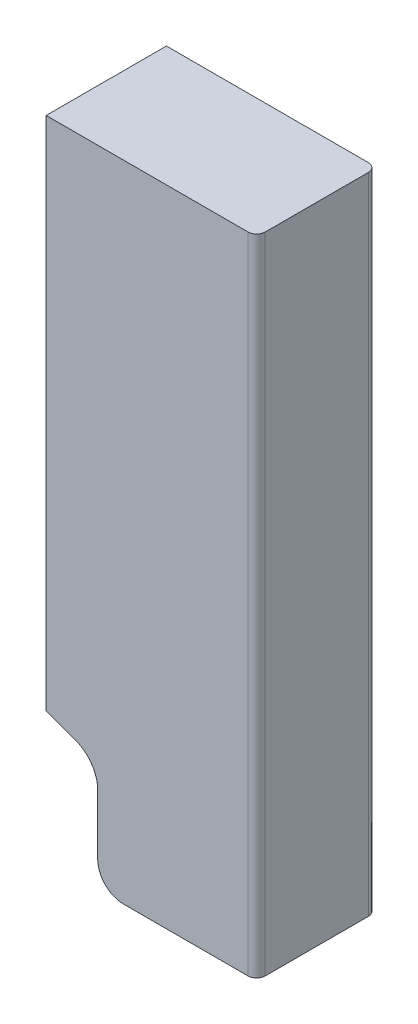
from build123d import *

# Parameters (mm, degrees)
SKETCH1_W           = 24.5
SKETCH1_H           = 14
BOSS_EXTRUDE1_DEPTH = 75
CUT_EXTRUDE1_REACH  = 79.273
FILLET1_R           = 3
FILLET2_R           = 1


with BuildPart() as part:
    # Sketch1 → Boss-Extrude1 (new body)
    with BuildSketch(Plane(origin=(0, 0, 0), x_dir=(1, 0, 0), z_dir=(0, 1, 0))):
        Rectangle(SKETCH1_W, SKETCH1_H)
    extrude(amount=-BOSS_EXTRUDE1_DEPTH)

    # Sketch2 → Cut-Extrude1 (cut, up to next)
    with BuildSketch(Plane.XY.offset(7), mode=Mode.PRIVATE) as cut_extrude1_sk1:
        with BuildLine():
            Line((-8.881919427, -61.241229517), (-12.25, -60.015348442))
            Line((-12.25, -60.015348442), (-12.25, -75))
            Line((-12.25, -75), (-6.25, -75))
            Line((-6.25, -75), (-6.25, -65))
            ThreePointArc((-6.25, -65), (-6.973391823, -62.705694255), (-8.881919427, -61.241229517))
        make_face()
    cut_extrude1_tool1 = extrude(cut_extrude1_sk1.sketch, amount=-CUT_EXTRUDE1_REACH, mode=Mode.PRIVATE) & part.part
    add(cut_extrude1_tool1.solids().sort_by_distance((-9.372504, -68.134359, 7))[0], mode=Mode.SUBTRACT)

    # Fillet1
    fillet1_edges = [part.edges().sort_by_distance(p)[0] for p in [
        (-6.25, -75, 0),
    ]]
    fillet(fillet1_edges, radius=FILLET1_R)

    # Fillet2
    fillet2_edges = [part.edges().sort_by_distance(p)[0] for p in [
        (12.25, -37.5, -7),
        (12.25, -37.5, 7),
    ]]
    fillet(fillet2_edges, radius=FILLET2_R)


solid = part.part
